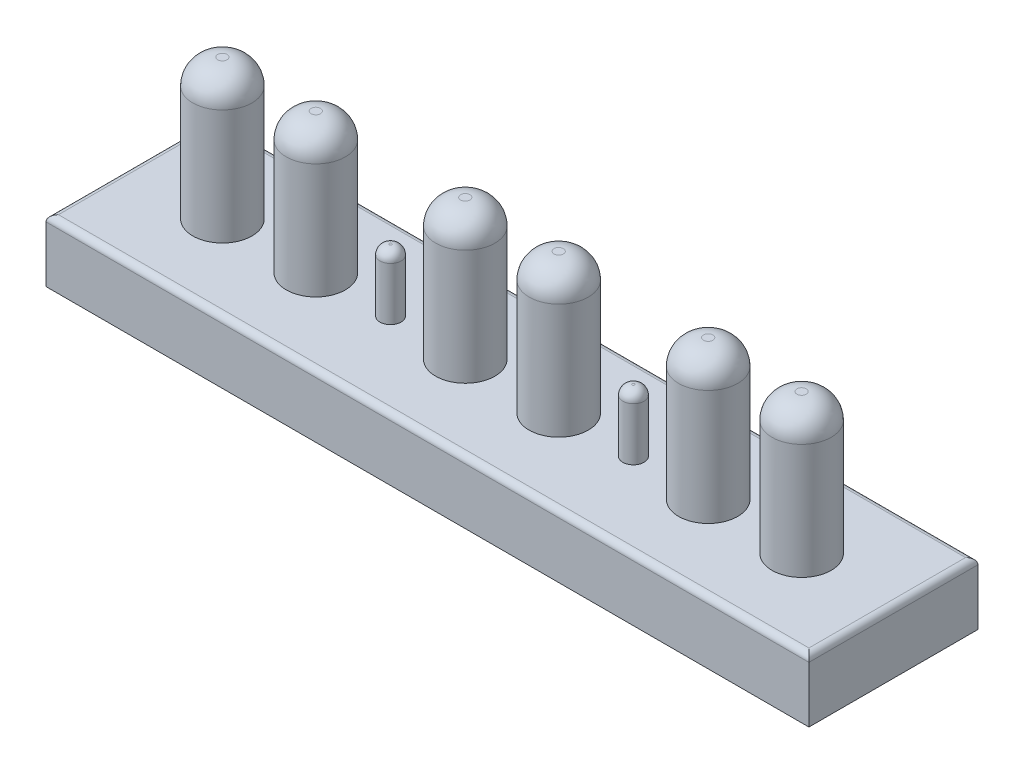
from build123d import *

# Parameters (mm, degrees)
ESQUISSE2_R          = 9.5
BOSS_EXTRU_1_DEPTH   = 45
BOSS_EXTRU_1_2_DEPTH = 45
BOSS_EXTRU_1_3_DEPTH = 45
BOSS_EXTRU_1_4_DEPTH = 45
BOSS_EXTRU_1_5_DEPTH = 45
BOSS_EXTRU_1_6_DEPTH = 45
ESQUISSE2_4_R        = 9.5
ESQUISSE2_4_R_2      = 3.4
BOSS_EXTRU_2_DEPTH   = 20
CONG_3_R             = 8
CONG_4_R             = 8
CONG_5_R             = 8
CONG_6_R             = 8
CONG_7_R             = 8
CONG_8_R             = 8
CONG_10_R            = 3
CONG_11_R            = 3
ESQUISSE4_W          = 245
ESQUISSE4_H          = 54.293120758
BOSS_EXTRU_3_DEPTH   = 20
CONG_12_R            = 2


with BuildPart() as part:
    # Esquisse2 → Boss.-Extru.1 (new body)
    with BuildSketch(Plane(origin=(0, 0, 0), x_dir=(1, 0, 0), z_dir=(0, 1, 0))):
        with Locations((32.457497884, 0)):
            Circle(ESQUISSE2_R)
    extrude(amount=BOSS_EXTRU_1_DEPTH)



with BuildPart() as body_2:
    # Esquisse2 → Boss.-Extru.1 2 (new body)
    with BuildSketch(Plane(origin=(0, 0, 0), x_dir=(1, 0, 0), z_dir=(0, 1, 0))):
        with Locations((62.457497884, 0)):
            Circle(ESQUISSE2_R)
    extrude(amount=BOSS_EXTRU_1_2_DEPTH)


with BuildPart() as body_3:
    # Esquisse2 → Boss.-Extru.1 3 (new body)
    with BuildSketch(Plane(origin=(0, 0, 0), x_dir=(1, 0, 0), z_dir=(0, 1, 0))):
        with Locations((-123.542502116, 0)):
            Circle(ESQUISSE2_R)
    extrude(amount=BOSS_EXTRU_1_3_DEPTH)


with BuildPart() as body_4:
    # Esquisse2 → Boss.-Extru.1 4 (new body)
    with BuildSketch(Plane(origin=(0, 0, 0), x_dir=(1, 0, 0), z_dir=(0, 1, 0))):
        with Locations((-93.542502116, 0)):
            Circle(ESQUISSE2_R)
    extrude(amount=BOSS_EXTRU_1_4_DEPTH)


with BuildPart() as body_5:
    # Esquisse2 → Boss.-Extru.1 5 (new body)
    with BuildSketch(Plane(origin=(0, 0, 0), x_dir=(1, 0, 0), z_dir=(0, 1, 0))):
        with Locations((-45.542502116, 0)):
            Circle(ESQUISSE2_R)
    extrude(amount=BOSS_EXTRU_1_5_DEPTH)


with BuildPart() as body_6:
    # Esquisse2 → Boss.-Extru.1 6 (new body)
    with BuildSketch(Plane(origin=(0, 0, 0), x_dir=(1, 0, 0), z_dir=(0, 1, 0))):
        with Locations((-15.542502116, 0)):
            Circle(ESQUISSE2_R)
    extrude(amount=BOSS_EXTRU_1_6_DEPTH)


with BuildPart() as part_1:
    add(part.part)

    add(body_2.part)  # Boss.-Extru.2 merges body 2

    add(body_3.part)  # Boss.-Extru.2 merges body 3

    add(body_4.part)  # Boss.-Extru.2 merges body 4

    add(body_5.part)  # Boss.-Extru.2 merges body 5

    add(body_6.part)  # Boss.-Extru.2 merges body 6
    # Esquisse2<4> → Boss.-Extru.2 (add)
    with BuildSketch(Plane(origin=(0, 0, 0), x_dir=(1, 0, 0), z_dir=(0, 1, 0))):
        with Locations((32.457497884, 0)):
            Circle(ESQUISSE2_4_R)
        with Locations((62.457497884, 0)):
            Circle(ESQUISSE2_4_R)
        with Locations((-123.542502116, 0)):
            Circle(ESQUISSE2_4_R)
        with Locations((-93.542502116, 0)):
            Circle(ESQUISSE2_4_R)
        with Locations((-45.542502116, 0)):
            Circle(ESQUISSE2_4_R)
        with Locations((-15.542502116, 0)):
            Circle(ESQUISSE2_4_R)
        with Locations((-69.542502116, 0)):
            Circle(ESQUISSE2_4_R_2)
        with Locations((8.457497884, 0)):
            Circle(ESQUISSE2_4_R_2)
    extrude(amount=BOSS_EXTRU_2_DEPTH)

    # Congé3
    cong_3_edges = [part_1.edges().sort_by_distance(p)[0] for p in [
        (-133.042502116, 45, 0),
    ]]
    fillet(cong_3_edges, radius=CONG_3_R)

    # Congé4
    cong_4_edges = [part_1.edges().sort_by_distance(p)[0] for p in [
        (-103.042502116, 45, 0),
    ]]
    fillet(cong_4_edges, radius=CONG_4_R)

    # Congé5
    cong_5_edges = [part_1.edges().sort_by_distance(p)[0] for p in [
        (-55.042502116, 45, 0),
    ]]
    fillet(cong_5_edges, radius=CONG_5_R)

    # Congé6
    cong_6_edges = [part_1.edges().sort_by_distance(p)[0] for p in [
        (-25.042502116, 45, 0),
    ]]
    fillet(cong_6_edges, radius=CONG_6_R)

    # Congé7
    cong_7_edges = [part_1.edges().sort_by_distance(p)[0] for p in [
        (22.957497884, 45, 0),
    ]]
    fillet(cong_7_edges, radius=CONG_7_R)

    # Congé8
    cong_8_edges = [part_1.edges().sort_by_distance(p)[0] for p in [
        (52.957497884, 45, 0),
    ]]
    fillet(cong_8_edges, radius=CONG_8_R)

    # Congé10
    cong_10_edges = [part_1.edges().sort_by_distance(p)[0] for p in [
        (-72.942502116, 20, 0),
    ]]
    fillet(cong_10_edges, radius=CONG_10_R)

    # Congé11
    cong_11_edges = [part_1.edges().sort_by_distance(p)[0] for p in [
        (5.057497884, 20, 0),
    ]]
    fillet(cong_11_edges, radius=CONG_11_R)

    # Esquisse4 → Boss.-Extru.3 (add)
    with BuildSketch(Plane(origin=(0, 0, 0), x_dir=(-1, 0, 0), z_dir=(0, -1, 0))):
        with Locations((30.542502116, 0)):
            Rectangle(ESQUISSE4_W, ESQUISSE4_H)
    extrude(amount=BOSS_EXTRU_3_DEPTH)

    # Congé12
    cong_12_edges = [part_1.edges().sort_by_distance(p)[0] for p in [
        (-153.042502116, 0, 0),
        (-30.542502116, 0, 27.146560379),
        (91.957497884, 0, 0),
        (-30.542502116, 0, -27.146560379),
    ]]
    fillet(cong_12_edges, radius=CONG_12_R)


solid = part_1.part
